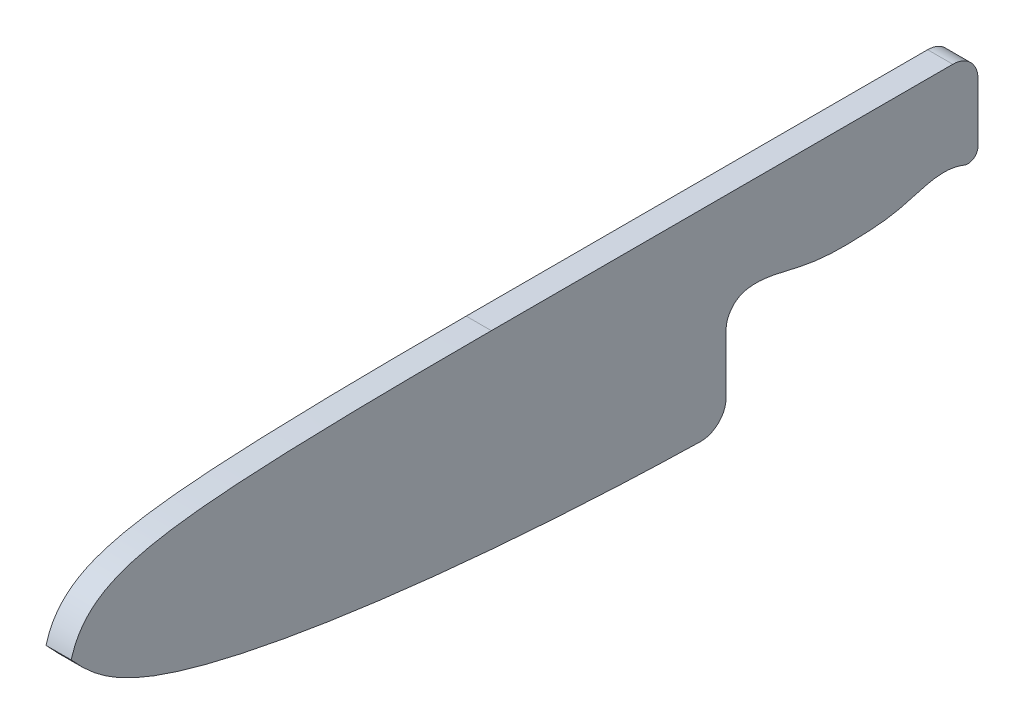
from build123d import *

# Parameters (mm, degrees)
EXTRUDE_1_DEPTH = 5
FILLET_6_R      = 5
FILLET_7_R      = 2
FILLET_8_R      = 5


# Read off the part's stored shape, not the designer's step: 凸台-拉伸1
with BuildPart() as part:
    # 凸台-拉伸1 outline → 凸台-拉伸1 (new body)
    with BuildSketch(Plane(origin=(0, 0, 0), x_dir=(0, 0, -1), z_dir=(1, 0, 0))):
        with BuildLine():
            add(Edge.make_bspline(
                [(0, -14.903846424), (2.951295662, -4.14849373), (13.496276672, -1.883966721), (29.52909514, 0), (83.401333812, 0)],
                knots=[0, 0, 0, 0, 0, 1, 1, 1, 1, 1], degree=4))
            add(Edge.make_bspline(
                [(0, -14.903846424), (7.045609734, -22.926953025), (13.86614676, -26.583220196), (29.227640995, -32.621761678), (74.300319088, -39.100169059), (130, -39.92714285)],
                knots=[0, 0, 0, 0, 0, 0, 0.966542999, 0.966542999, 0.966542999, 0.966542999, 0.966542999, 0.966542999], degree=5))
            Line((130, -39.92714285), (130, -20))
            add(Edge.make_bspline(
                [(130, -20), (142.554964398, -11.053747082), (149.196912904, -34.934175524), (158.630756241, -5.373255264), (163.289648635, -33.936740498), (166.072200522, -10.144868391), (180, -20)],
                knots=[0, 0, 0, 0, 0, 0, 0, 1, 1, 1, 1, 1, 1, 1], degree=6))
            Line((180, -20), (180, 0))
            Line((180, 0), (83.401333812, 0))
        make_face()
    extrude(amount=EXTRUDE_1_DEPTH)

    # 圆角6
    fillet_6_edges = [part.edges().sort_by_distance(p)[0] for p in [
        (2.5, -20, -130),
    ]]
    fillet(fillet_6_edges, radius=FILLET_6_R)

    # 圆角7
    fillet_7_edges = [part.edges().sort_by_distance(p)[0] for p in [
        (2.5, -20, -180),
    ]]
    fillet(fillet_7_edges, radius=FILLET_7_R)

    # 圆角8
    fillet_8_edges = [part.edges().sort_by_distance(p)[0] for p in [
        (2.5, 0, -180),
        (2.5, -39.92714285, -130),
    ]]
    fillet(fillet_8_edges, radius=FILLET_8_R)


solid = part.part
